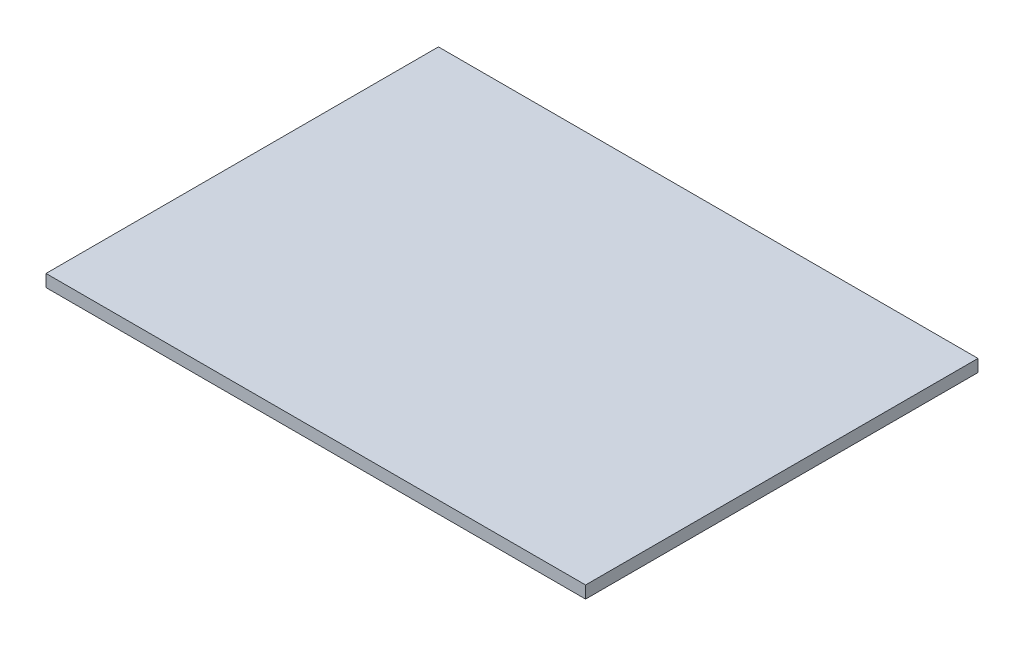
from build123d import *

# Parameters (mm, degrees)
SKETCH1_W           = 279.4
SKETCH1_H           = 203.2
BOSS_EXTRUDE1_DEPTH = 6.35


with BuildPart() as part:
    # Sketch1 → Boss-Extrude1 (new body)
    with BuildSketch(Plane(origin=(0, 0, 0), x_dir=(1, 0, 0), z_dir=(0, 1, 0))):
        Rectangle(SKETCH1_W, SKETCH1_H)
    extrude(amount=BOSS_EXTRUDE1_DEPTH)


solid = part.part
